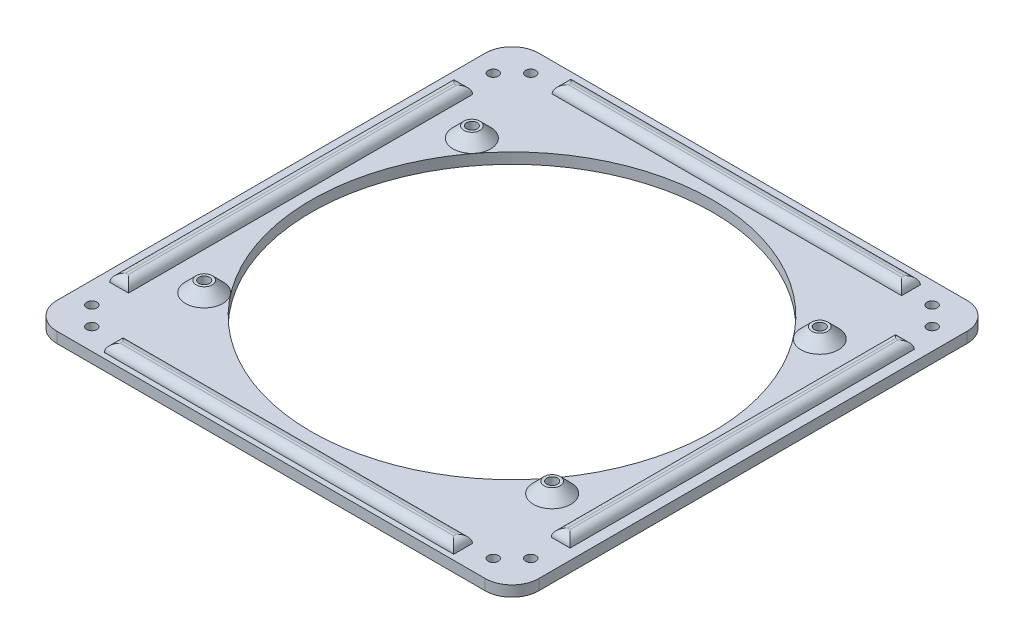
from build123d import *

# Parameters (mm, degrees)
SKETCH_1_W          = 180
SKETCH_1_H          = 180
SKETCH_1_R          = 1.9
SKETCH_1_R_2        = 75
EXTRUDE_1_DEPTH     = 4
FILLET_1_R          = 10
SKETCH_2_R          = 3
SKETCH_2_R_2        = 2
EXTRUDE_2_DEPTH     = 4
CHAMFER_1_SIZE      = 4
CUT_EXTRUDE_START   = -7
SKETCH_3_R          = 2
CUT_EXTRUDE_1_DEPTH = 7
SKETCH_4_W          = 7
SKETCH_4_H          = 128.601205204
SKETCH_4_W_2        = 130.561529492
SKETCH_4_H_2        = 7
EXTRUDE_3_DEPTH     = 3
FILLET_2_R          = 3


with BuildPart() as part:
    # Эскиз1 → Бобышка-Вытянуть1 (new body)
    with BuildSketch(Plane(origin=(0, 0, 0), x_dir=(1, 0, 0), z_dir=(0, 1, 0))):
        Rectangle(SKETCH_1_W, SKETCH_1_H)
        with Locations(Location((75, 82, 0), (0, 0, 270))):
            Circle(SKETCH_1_R, mode=Mode.SUBTRACT)
        with Locations(Location((82, 75, 0), (0, 0, 270))):
            Circle(SKETCH_1_R, mode=Mode.SUBTRACT)
        with Locations(Location((-82, 75, 0), (0, 0, 90))):
            Circle(SKETCH_1_R, mode=Mode.SUBTRACT)
        with Locations(Location((-75, 82, 0), (0, 0, 90))):
            Circle(SKETCH_1_R, mode=Mode.SUBTRACT)
        with Locations(Location((-82, -75, 0), (0, 0, 270))):
            Circle(SKETCH_1_R, mode=Mode.SUBTRACT)
        with Locations(Location((-75, -82, 0), (0, 0, 270))):
            Circle(SKETCH_1_R, mode=Mode.SUBTRACT)
        with Locations(Location((75, -82, 0), (0, 0, 90))):
            Circle(SKETCH_1_R, mode=Mode.SUBTRACT)
        with Locations(Location((82, -75, 0), (0, 0, 90))):
            Circle(SKETCH_1_R, mode=Mode.SUBTRACT)
        with Locations(Location((0, 0, 0), (0, 0, 270))):
            Circle(SKETCH_1_R_2, mode=Mode.SUBTRACT)
    extrude(amount=EXTRUDE_1_DEPTH)

    # Скругление1
    fillet_1_edges = [part.edges().sort_by_distance(p)[0] for p in [
        (90, 2, 90),
        (-90, 2, 90),
        (-90, 2, -90),
        (90, 2, -90),
    ]]
    fillet(fillet_1_edges, radius=FILLET_1_R)

    # Эскиз2 → Бобышка-Вытянуть2 (add)
    # profile 1 of 4: a face of its own
    with BuildSketch(Plane(origin=(0, 4, 0), x_dir=(1, 0, 0), z_dir=(0, 1, 0))):
        with Locations(Location((-65, 50, 0), (0, 0, 90))):
            Circle(SKETCH_2_R)
        with Locations(Location((-65, 50, 0), (0, 0, 270))):
            Circle(SKETCH_2_R_2, mode=Mode.SUBTRACT)
    # profile 2 of 4: a face of its own
    with BuildSketch(Plane(origin=(0, 4, 0), x_dir=(1, 0, 0), z_dir=(0, 1, 0))):
        with Locations(Location((65, 50, 0), (0, 0, 90))):
            Circle(SKETCH_2_R)
        with Locations(Location((65, 50, 0), (0, 0, 90))):
            Circle(SKETCH_2_R_2, mode=Mode.SUBTRACT)
    # profile 3 of 4: a face of its own
    with BuildSketch(Plane(origin=(0, 4, 0), x_dir=(1, 0, 0), z_dir=(0, 1, 0))):
        with Locations(Location((65, -50, 0), (0, 0, 90))):
            Circle(SKETCH_2_R)
        with Locations(Location((65, -50, 0), (0, 0, 270))):
            Circle(SKETCH_2_R_2, mode=Mode.SUBTRACT)
    # profile 4 of 4: a face of its own
    with BuildSketch(Plane(origin=(0, 4, 0), x_dir=(1, 0, 0), z_dir=(0, 1, 0))):
        with Locations(Location((-65, -50, 0), (0, 0, 90))):
            Circle(SKETCH_2_R)
        with Locations(Location((-65, -50, 0), (0, 0, 90))):
            Circle(SKETCH_2_R_2, mode=Mode.SUBTRACT)
    extrude(amount=EXTRUDE_2_DEPTH)

    # Фаска1
    chamfer_1_edges = [part.edges().sort_by_distance(p)[0] for p in [
        (-65, 4, -47),
        (65, 4, -47),
        (65, 4, 53),
        (-65, 4, 53),
    ]]
    chamfer(chamfer_1_edges, length=CHAMFER_1_SIZE - 0.0001)  # a hair under: the kernel refuses the full size

    # Эскиз3 → Вырез-Вытянуть1 (cut)
    with BuildSketch(Plane(origin=(0, 8, 0), x_dir=(1, 0, 0), z_dir=(0, 1, 0)).offset(CUT_EXTRUDE_START)):
        with Locations(Location((-65, 50, 0), (0, 0, 270))):
            Circle(SKETCH_3_R)
        with Locations(Location((65, 50, 0), (0, 0, 90))):
            Circle(SKETCH_3_R)
        with Locations(Location((65, -50, 0), (0, 0, 270))):
            Circle(SKETCH_3_R)
        with Locations(Location((-65, -50, 0), (0, 0, 90))):
            Circle(SKETCH_3_R)
    extrude(amount=CUT_EXTRUDE_1_DEPTH, mode=Mode.SUBTRACT)

    # Эскиз4 → Бобышка-Вытянуть3 (add)
    with BuildSketch(Plane(origin=(0, 4, 0), x_dir=(1, 0, 0), z_dir=(0, 1, 0))):
        with Locations((-82.5, 0)):
            Rectangle(SKETCH_4_W, SKETCH_4_H)
        with Locations((82.5, 0)):
            Rectangle(SKETCH_4_W, SKETCH_4_H)
        with Locations((0.989102496, -84.539172171)):
            Rectangle(SKETCH_4_W_2, SKETCH_4_H_2)
        with Locations((0.989102496, 82.793697178)):
            Rectangle(SKETCH_4_W_2, SKETCH_4_H_2)
    extrude(amount=EXTRUDE_3_DEPTH)

    # Скругление2
    fillet_2_edges = [part.edges().sort_by_distance(p)[0] for p in [
        (-82.5, 7, 64.300602602),
        (-86, 7, 0),
        (-82.5, 7, -64.300602602),
        (-79, 7, 0),
        (0.989102496, 7, 81.039172171),
        (66.269867242, 7, 84.539172171),
        (0.989102496, 7, 88.039172171),
        (-64.29166225, 7, 84.539172171),
        (82.5, 7, 64.300602602),
        (79, 7, 0),
        (82.5, 7, -64.300602602),
        (86, 7, 0),
        (0.989102496, 7, -79.293697178),
        (-64.29166225, 7, -82.793697178),
        (0.989102496, 7, -86.293697178),
        (66.269867242, 7, -82.793697178),
    ]]
    fillet(fillet_2_edges, radius=FILLET_2_R - 0.0001)  # a hair under: the kernel refuses the full size


solid = part.part
